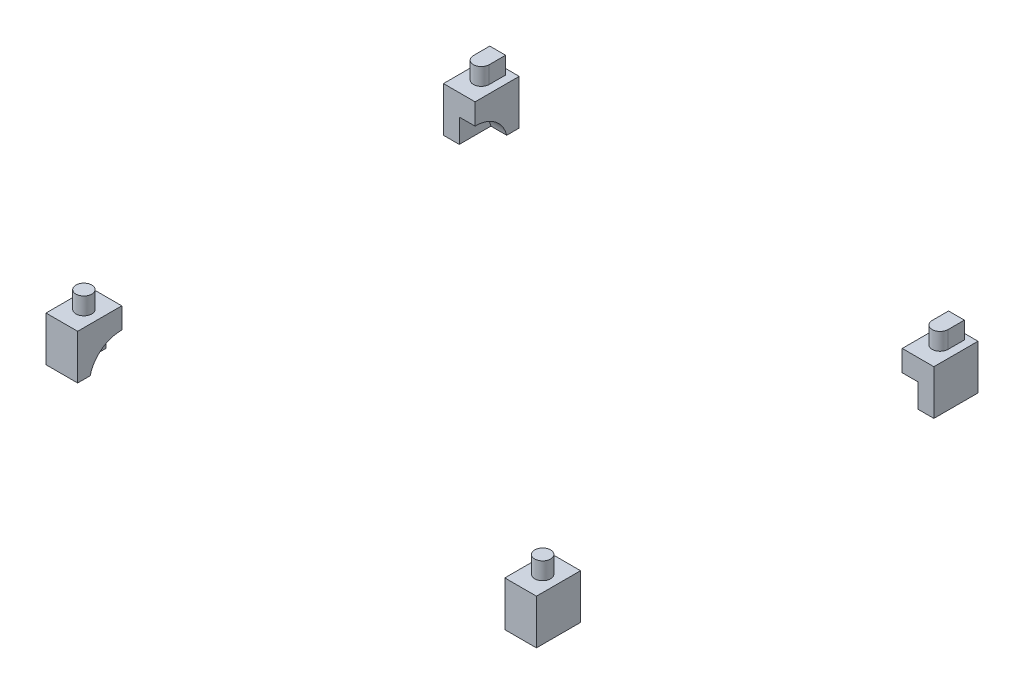
from build123d import *

# Parameters (mm, degrees)
SKETCH1_W             = 3
SKETCH1_H             = 4.18419334
BOSS_EXTRUDE1_DEPTH   = 4.25
BOSS_EXTRUDE1_2_DEPTH = 4.25
BOSS_EXTRUDE1_3_DEPTH = 4.25
BOSS_EXTRUDE1_4_DEPTH = 4.25
SKETCH2_W             = 43.5
SKETCH2_H             = 39.5
CUT_EXTRUDE1_DEPTH    = 2.25
FILLET1_R             = 3
FILLET2_R             = 3
SKETCH3_R             = 0.75
BOSS_EXTRUDE2_DEPTH   = 1.63
FILLET3_R             = 3
FILLET4_START         = -22.75
FILLET4_DEPTH         = 1.5
SKETCH4_W             = 1.5
SKETCH4_H             = 1.55
BOSS_EXTRUDE3_DEPTH   = 1.63
SKETCH5_W             = 1.5
SKETCH5_H             = 1.55
BOSS_EXTRUDE4_DEPTH   = 1.63


with BuildPart() as part:
    # Sketch1 → Boss-Extrude1 (new body)
    with BuildSketch(Plane.XZ.offset(1.506798548)):
        with Locations((-22.75, -3.65790333)):
            Rectangle(SKETCH1_W, SKETCH1_H)
    extrude(amount=BOSS_EXTRUDE1_DEPTH)


with BuildPart() as body_2:
    # Sketch1 → Boss-Extrude1 2 (new body)
    with BuildSketch(Plane.XZ.offset(1.506798548)):
        with Locations((20.75, -3.65790333)):
            Rectangle(SKETCH1_W, SKETCH1_H)
    extrude(amount=BOSS_EXTRUDE1_2_DEPTH)


with BuildPart() as body_3:
    # Sketch1 → Boss-Extrude1 3 (new body)
    with BuildSketch(Plane.XZ.offset(1.506798548)):
        with Locations((20.75, -41.34209667)):
            Rectangle(SKETCH1_W, SKETCH1_H)
    extrude(amount=BOSS_EXTRUDE1_3_DEPTH)


with BuildPart() as body_4:
    # Sketch1 → Boss-Extrude1 4 (new body)
    with BuildSketch(Plane.XZ.offset(1.506798548)):
        with Locations((-22.75, -41.34209667)):
            Rectangle(SKETCH1_W, SKETCH1_H)
    extrude(amount=BOSS_EXTRUDE1_4_DEPTH)


with BuildPart() as cut_extrude1_tool:
    # Sketch2 → Cut-Extrude1 (new body)
    with BuildSketch(Plane.XZ.offset(5.756798548)):
        with Locations((-1, -22.5)):
            Rectangle(SKETCH2_W, SKETCH2_H)
    extrude(amount=-CUT_EXTRUDE1_DEPTH)


with BuildPart() as part_1:
    add(part.part)

    # Cut-Extrude1: cut by cut_extrude1_tool
    add(cut_extrude1_tool.part, mode=Mode.SUBTRACT)

    # Fillet1
    # the kernel refuses this fillet: 3 mm, written as the material it adds along each edge
    with BuildSketch(Plane(origin=(-22.75, -3.506798548, -2.75), x_dir=(0, 0, -1), z_dir=(1, 0, 0))) as fillet1_piece_1:
        with BuildLine():
            CenterArc((2.90473751, -3), FILLET1_R, 90, 75.522487814)
            Line((0, -2.25), (-0.05809475, -2.235))
            ThreePointArc((-0.05809475, -2.235), (-0.06, -1.125), (-0.06, 0))
            Line((-0.06, 0), (0, 0.06))
            Line((0, 0.06), (2.90473751, 0.06))
            Line((2.90473751, 0.06), (2.90473751, 0))
        make_face()
    extrude(amount=1.5)



with BuildPart() as body_2_1:
    add(body_2.part)

    # Cut-Extrude1: cut by cut_extrude1_tool
    add(cut_extrude1_tool.part, mode=Mode.SUBTRACT)

    # Fillet2
    # the kernel refuses this fillet: 3 mm, written as the material it adds along each edge
    with BuildSketch(Plane(origin=(19.25, -3.506798548, -2.75), x_dir=(0, 0, -1), z_dir=(1, 0, 0))) as fillet2_piece_1:
        with BuildLine():
            CenterArc((2.90473751, -3), FILLET2_R, 90, 75.522487814)
            Line((0, -2.25), (-0.05809475, -2.235))
            ThreePointArc((-0.05809475, -2.235), (-0.06, -1.125), (-0.06, 0))
            Line((-0.06, 0), (0, 0.06))
            Line((0, 0.06), (2.90473751, 0.06))
            Line((2.90473751, 0.06), (2.90473751, 0))
        make_face()
    extrude(amount=1.5)


with BuildPart() as body_3_1:
    add(body_3.part)

    # Cut-Extrude1: cut by cut_extrude1_tool
    add(cut_extrude1_tool.part, mode=Mode.SUBTRACT)

    # Fillet3
    # the kernel refuses this fillet: 3 mm, written as the material it adds along each edge
    with BuildSketch(Plane(origin=(20.75, -3.506798548, -42.25), x_dir=(0, 0, 1), z_dir=(-1, 0, 0))) as fillet3_piece_1:
        with BuildLine():
            CenterArc((2.90473751, -3), FILLET3_R, 90, 75.522487814)
            Line((0, -2.25), (-0.05809475, -2.235))
            ThreePointArc((-0.05809475, -2.235), (-0.06, -1.125), (-0.06, 0))
            Line((-0.06, 0), (0, 0.06))
            Line((0, 0.06), (2.90473751, 0.06))
            Line((2.90473751, 0.06), (2.90473751, 0))
        make_face()
    extrude(amount=1.5)


with BuildPart() as body_4_1:
    add(body_4.part)

    # Cut-Extrude1: cut by cut_extrude1_tool
    add(cut_extrude1_tool.part, mode=Mode.SUBTRACT)

    # Fillet4: read off the stored shape, not the designer's step
    # Fillet4 outline → Fillet4 (add)
    with BuildSketch(Plane.YZ.offset(FILLET4_START)):
        with BuildLine():
            add(Edge.make_bspline(
                [(-5.756798548, -42.25), (-3.506798548, -41.669052498), (-3.506798548, -39.34526249)],
                knots=[0, 0, 0, 1, 1, 1], degree=2, weights=[1, 0.790569415, 1]))
            Line((-5.756798548, -42.25), (-3.506798548, -42.25))
            Line((-3.506798548, -42.25), (-3.506798548, -39.34526249))
        make_face()
    extrude(amount=FILLET4_DEPTH)


with BuildPart() as part_2:
    add(part_1.part)

    add(body_2_1.part)  # Boss-Extrude2 merges body 2
    # Sketch3 → Boss-Extrude2 (add)
    with BuildSketch(Plane(origin=(0, -1.506798548, 0), x_dir=(1, 0, 0), z_dir=(0, 1, 0))):
        with Locations(Location((20.75, 3.65790333, 0), (0, 0, 270))):
            Circle(SKETCH3_R)
        with Locations(Location((-22.75, 3.65790333, 0), (0, 0, 90))):
            Circle(SKETCH3_R)
        with Locations(Location((20.75, 41.34209667, 0), (0, 0, 270))):
            Circle(SKETCH3_R)
        with Locations(Location((-22.75, 41.34209667, 0), (0, 0, 270))):
            Circle(SKETCH3_R)
    extrude(amount=BOSS_EXTRUDE2_DEPTH)


    add(body_4_1.part)  # Boss-Extrude3 merges body 4
    # Sketch4 → Boss-Extrude3 (add)
    with BuildSketch(Plane(origin=(0, 0.123201452, 0), x_dir=(1, 0, 0), z_dir=(0, 1, 0))):
        with Locations((-22.75, 42.11709667)):
            Rectangle(SKETCH4_W, SKETCH4_H)
    extrude(amount=-BOSS_EXTRUDE3_DEPTH)


    add(body_3_1.part)  # Boss-Extrude4 merges body 3
    # Sketch5 → Boss-Extrude4 (add)
    with BuildSketch(Plane(origin=(0, 0.123201452, 0), x_dir=(1, 0, 0), z_dir=(0, 1, 0))):
        with Locations((20.75, 42.11709667)):
            Rectangle(SKETCH5_W, SKETCH5_H)
    extrude(amount=-BOSS_EXTRUDE4_DEPTH)


solid = part_2.part
